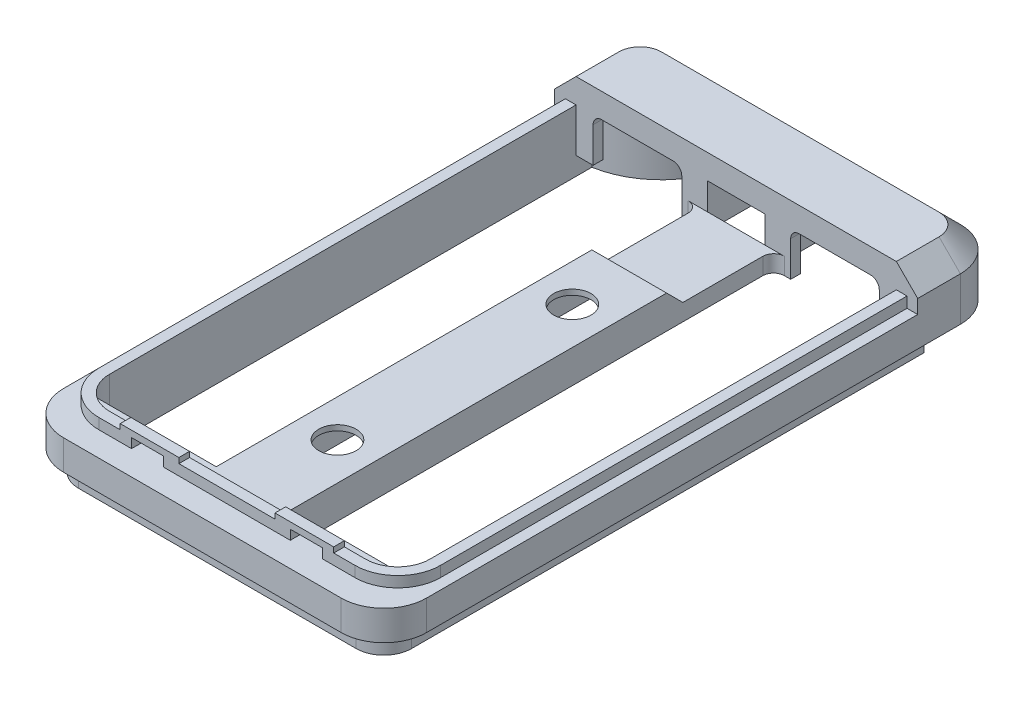
from build123d import *
from build123d.topology import SkipClean

# Parameters (mm, degrees)
BOSS_EXTRUDE2_DEPTH      = 5.8
BOSS_EXTRUDE5_DEPTH      = 17
BOSS_EXTRUDE5_DEPTH_BACK = 17
SKETCH20_W               = 8
SKETCH20_H               = 2.3
CUT_EXTRUDE3_DEPTH       = 35.112167917
BOSS_EXTRUDE6_DEPTH      = 5.8
CHAMFER1_SIZE            = 2
CUT_EXTRUDE4_START       = -1
CUT_EXTRUDE4_DEPTH       = 1
CUT_EXTRUDE5_DEPTH       = 35.112167917
BOSS_EXTRUDE8_DEPTH      = 5.8
SKETCH28_W               = 5.5
SKETCH28_H               = 1
BOSS_EXTRUDE9_DEPTH      = 0.5
CUT_EXTRUDE6_DEPTH       = 1
CUT_EXTRUDE7_DEPTH       = 2
CUT_EXTRUDE14_START      = -1.9
SKETCH45_W               = 3
SKETCH45_H               = 0.9
CUT_EXTRUDE14_DEPTH      = 1.9
CUT_EXTRUDE11_DEPTH      = 0.9
SKETCH40_W               = 30
SKETCH40_H               = 0.9
BOSS_EXTRUDE11_DEPTH     = 4.1
CUT_EXTRUDE12_REACH      = 55.429
CUT_EXTRUDE13_REACH      = 55.429
SKETCH47_W               = 0.6
SKETCH47_H               = 5
BOSS_EXTRUDE13_DEPTH     = 5.1
BOSS_EXTRUDE14_DEPTH     = 5.8
CUT_EXTRUDE23_DEPTH      = 6.7
BOSS_EXTRUDE15_DEPTH     = 1
SKETCH43_W               = 5.4
SKETCH43_H               = 0.5
SKETCH43_W_2             = 0.8
SKETCH43_H_2             = 1.075370029
BOSS_EXTRUDE17_DEPTH     = 45.2
SKETCH53_W               = 7
SKETCH53_H               = 36.7
BOSS_EXTRUDE18_DEPTH     = 1.52463
CHAMFER3_SIZE            = 1.52
CUT_EXTRUDE24_START      = -2.02463
SKETCH56_R               = 1.75
CUT_EXTRUDE24_DEPTH      = 2.02463
FILLET1_R                = 1
SKETCH57_W               = 5.4
SKETCH57_H               = 35.18
CUT_EXTRUDE25_DEPTH      = 1.52
CHAMFER4_SIZE            = 1.52
SKETCH59_W               = 0.8
SKETCH59_H               = 2.1
BOSS_EXTRUDE21_DEPTH     = 1.5
SKETCH61_W               = 4.290499921
SKETCH61_H               = 0.6
BOSS_EXTRUDE23_DEPTH     = 3.8
SKETCH64_W               = 4.8
SKETCH64_H               = 0.6
CUT_EXTRUDE26_DEPTH      = 1.7
CUT_EXTRUDE27_START      = -4.295370029
CUT_EXTRUDE27_DEPTH      = 4.295370029


with BuildPart() as part:
    # Sketch1 → Boss-Extrude2 (new body)
    with BuildSketch(Plane(origin=(0, 0, 0), x_dir=(1, 0, 0), z_dir=(0, 1, 0))):
        with BuildLine():
            Line((-13, 29), (13, 29))
            ThreePointArc((13, 29), (15.828427125, 27.828427125), (17, 25))
            Line((17, 25), (17, -25))
            ThreePointArc((17, -25), (15.828427125, -27.828427125), (13, -29))
            Line((13, -29), (-13, -29))
            ThreePointArc((-13, -29), (-15.828427125, -27.828427125), (-17, -25))
            Line((-17, -25), (-17, 25))
            ThreePointArc((-17, 25), (-15.828427125, 27.828427125), (-13, 29))
        make_face()
        with BuildLine():
            Line((-11, 27), (11, 27))
            ThreePointArc((11, 27), (13.828427125, 25.828427125), (15, 23))
            Line((15, 23), (15, -23))
            ThreePointArc((15, -23), (13.828427125, -25.828427125), (11, -27))
            Line((11, -27), (-11, -27))
            ThreePointArc((-11, -27), (-13.828427125, -25.828427125), (-15, -23))
            Line((-15, -23), (-15, 23))
            ThreePointArc((-15, 23), (-13.828427125, 25.828427125), (-11, 27))
        make_face(mode=Mode.SUBTRACT)
    extrude(amount=BOSS_EXTRUDE2_DEPTH)

    # Sketch20 → Boss-Extrude5 (add, two sides: drawn at the far end of the back side and taken through both)
    with BuildSketch(Plane(origin=(0, 0, 0), x_dir=(0, 0, -1), z_dir=(1, 0, 0)).offset(-BOSS_EXTRUDE5_DEPTH_BACK)):
        with Locations((25, 6.95)):
            Rectangle(SKETCH20_W, SKETCH20_H)
    extrude(amount=BOSS_EXTRUDE5_DEPTH + BOSS_EXTRUDE5_DEPTH_BACK)

    # Sketch22 → Cut-Extrude3 (cut, through all)
    with BuildSketch(Plane.XZ.offset(-5.8)):
        with BuildLine():
            Line((-17, -25), (-17, -29))
            Line((-17, -29), (-13, -29))
            ThreePointArc((-13, -29), (-15.828427125, -27.828427125), (-17, -25))
        make_face()
        with BuildLine():
            Line((13, -29), (17, -29))
            Line((17, -29), (17, -25))
            ThreePointArc((17, -25), (15.828427125, -27.828427125), (13, -29))
        make_face()
    extrude(amount=-CUT_EXTRUDE3_DEPTH, mode=Mode.SUBTRACT)

    # Sketch23 → Boss-Extrude6 (add, through all)
    with BuildSketch(Plane(origin=(0, 5.8, 0), x_dir=(1, 0, 0), z_dir=(0, 1, 0))):
        with BuildLine():
            Line((-17, -24.2), (17, -24.2))
            Line((17, -24.2), (17, -25))
            ThreePointArc((17, -25), (15.828427125, -27.828427125), (13, -29))
            Line((13, -29), (-13, -29))
            ThreePointArc((-13, -29), (-15.828427125, -27.828427125), (-17, -25))
            Line((-17, -25), (-17, -24.2))
        make_face()
    extrude(amount=-BOSS_EXTRUDE6_DEPTH)

    # Chamfer1
    chamfer1_edges = [part.edges().sort_by_distance(p)[0] for p in [
        (0, 8.1, -29),
        (-17, 8.1, -23),
        (17, 8.1, -23),
        (-15.828427125, 8.1, -27.828427125),
        (15.828427125, 8.1, -27.828427125),
    ]]
    chamfer(chamfer1_edges, length=CHAMFER1_SIZE)

    # Sketch26 → Cut-Extrude4 (cut)
    with BuildSketch(Plane(origin=(0, 5.8, 0), x_dir=(1, 0, 0), z_dir=(0, 1, 0)).offset(CUT_EXTRUDE4_START)):
        with BuildLine():
            Line((-16, 21), (-17, 21))
            Line((-17, 21), (-17, -25))
            ThreePointArc((-17, -25), (-15.828427125, -27.828427125), (-13, -29))
            Line((-13, -29), (13, -29))
            ThreePointArc((13, -29), (15.828427125, -27.828427125), (17, -25))
            Line((17, -25), (17, 21))
            Line((17, 21), (16, 21))
            Line((16, 21), (16, -22.7))
            ThreePointArc((16, -22.7), (14.828427125, -25.528427125), (12, -26.7))
            Line((12, -26.7), (-12, -26.7))
            ThreePointArc((-12, -26.7), (-14.828427125, -25.528427125), (-16, -22.7))
            Line((-16, -22.7), (-16, 21))
        make_face()
    extrude(amount=CUT_EXTRUDE4_DEPTH, mode=Mode.SUBTRACT)

    # Sketch27 → Cut-Extrude5 (cut, through all)
    with BuildSketch(Plane(origin=(0, 5.8, 0), x_dir=(1, 0, 0), z_dir=(0, 1, 0))):
        with BuildLine():
            Line((-15, -22.7), (15, -22.7))
            ThreePointArc((15, -22.7), (14.121320344, -24.821320344), (12, -25.7))
            Line((12, -25.7), (-12, -25.7))
            ThreePointArc((-12, -25.7), (-14.121320344, -24.821320344), (-15, -22.7))
        make_face()
    extrude(amount=-CUT_EXTRUDE5_DEPTH, mode=Mode.SUBTRACT)

    # Sketch25 → Boss-Extrude8 (add, through all)
    with BuildSketch(Plane(origin=(0, 5.8, 0), x_dir=(1, 0, 0), z_dir=(0, 1, 0))):
        with BuildLine():
            Line((15, 21), (15, -22.7))
            ThreePointArc((15, -22.7), (14.121320344, -24.821320344), (12, -25.7))
            Line((12, -25.7), (-12, -25.7))
            ThreePointArc((-12, -25.7), (-14.121320344, -24.821320344), (-15, -22.7))
            Line((-15, -22.7), (-15, 21))
            Line((-15, 21), (-16, 21))
            Line((-16, 21), (-16, -22.7))
            ThreePointArc((-16, -22.7), (-14.828427125, -25.528427125), (-12, -26.7))
            Line((-12, -26.7), (12, -26.7))
            ThreePointArc((12, -26.7), (14.828427125, -25.528427125), (16, -22.7))
            Line((16, -22.7), (16, 21))
            Line((16, 21), (15, 21))
        make_face()
    extrude(amount=-BOSS_EXTRUDE8_DEPTH)

    # Sketch28 → Boss-Extrude9 (add)
    with BuildSketch(Plane(origin=(0, 5.8, 0), x_dir=(1, 0, 0), z_dir=(0, 1, 0))):
        with Locations((-7.25, -26.2)):
            Rectangle(SKETCH28_W, SKETCH28_H)
        with Locations((7.25, -26.2)):
            Rectangle(SKETCH28_W, SKETCH28_H)
    extrude(amount=BOSS_EXTRUDE9_DEPTH)

    # Sketch29 → Cut-Extrude6 (cut)
    with BuildSketch(Plane.XY.offset(26.7)):
        Polygon((-7.434487223, 4.8), (-5.934487223, 4.8), (-5.934487223, 5.7), (-8.934487223, 5.7), (-8.934487223, 4.8), align=None)
        Polygon((8.934487223, 5.7), (5.934487223, 5.7), (5.934487223, 4.8), (7.434487223, 4.8), (8.934487223, 4.8), align=None)
    extrude(amount=-CUT_EXTRUDE6_DEPTH, mode=Mode.SUBTRACT)

    # Sketch33 → Cut-Extrude7 (cut)
    with BuildSketch(Plane.XZ):
        with BuildLine():
            Line((-13, -29), (13, -29))
            ThreePointArc((13, -29), (15.828427125, -27.828427125), (17, -25))
            Line((17, -25), (17, 25))
            ThreePointArc((17, 25), (15.828427125, 27.828427125), (13, 29))
            Line((13, 29), (-13, 29))
            ThreePointArc((-13, 29), (-15.828427125, 27.828427125), (-17, 25))
            Line((-17, 25), (-17, -25))
            ThreePointArc((-17, -25), (-15.828427125, -27.828427125), (-13, -29))
        make_face()
        with BuildLine():
            Line((-15.6, 25), (-15.6, -25))
            ThreePointArc((-15.6, -25), (-14.838477631, -26.838477631), (-13, -27.6))
            Line((-13, -27.6), (13, -27.6))
            ThreePointArc((13, -27.6), (14.838477631, -26.838477631), (15.6, -25))
            Line((15.6, -25), (15.6, 25))
            ThreePointArc((15.6, 25), (14.838477631, 26.838477631), (13, 27.6))
            Line((13, 27.6), (-13, 27.6))
            ThreePointArc((-13, 27.6), (-14.838477631, 26.838477631), (-15.6, 25))
        make_face(mode=Mode.SUBTRACT)
    extrude(amount=-CUT_EXTRUDE7_DEPTH, mode=Mode.SUBTRACT)

    # Sketch45 → Cut-Extrude14 (cut)
    with BuildSketch(Plane.XY.offset(27.6).offset(CUT_EXTRUDE14_START)):
        with Locations((7.434487223, 1.55)):
            Rectangle(SKETCH45_W, SKETCH45_H)
        with Locations((-7.434487223, 1.55)):
            Rectangle(SKETCH45_W, SKETCH45_H)
    extrude(amount=CUT_EXTRUDE14_DEPTH, mode=Mode.SUBTRACT)

    # Sketch39 → Cut-Extrude11 (cut)
    with BuildSketch(Plane.XZ.offset(-5.8)):
        with BuildLine():
            Line((15, -21.9), (-15, -21.9))
            Line((-15, -21.9), (-15, -23))
            ThreePointArc((-15, -23), (-13.828427125, -25.828427125), (-11, -27))
            Line((-11, -27), (11, -27))
            ThreePointArc((11, -27), (13.828427125, -25.828427125), (15, -23))
            Line((15, -23), (15, -21.9))
        make_face()
    extrude(amount=-CUT_EXTRUDE11_DEPTH, mode=Mode.SUBTRACT)

    # Sketch40 → Boss-Extrude11 (add)
    with BuildSketch(Plane.XZ.offset(-5.8)):
        with Locations((0, -21.45)):
            Rectangle(SKETCH40_W, SKETCH40_H)
    extrude(amount=BOSS_EXTRUDE11_DEPTH)

    # Sketch38 → Cut-Extrude12 (cut, up to next)
    with BuildSketch(Plane.XY.offset(-21), mode=Mode.PRIVATE) as cut_extrude12_sk1:
        Polygon((2.7, 5.8), (0, 5.8), (-2.7, 5.8), (-2.7, 1.285789379), (2.7, 1.285789379), align=None)
    cut_extrude12_tool1 = extrude(cut_extrude12_sk1.sketch, amount=-CUT_EXTRUDE12_REACH, mode=Mode.PRIVATE) & part.part
    add(cut_extrude12_tool1.solids().sort_by_distance((0, 3.542895, -21))[0], mode=Mode.SUBTRACT)

    # Sketch41 → Cut-Extrude13 (cut, up to next)
    with BuildSketch(Plane.XY.offset(-21), mode=Mode.PRIVATE) as cut_extrude13_sk1:
        with BuildLine():
            Line((5.9, 5.8), (12.6, 5.8))
            ThreePointArc((12.6, 5.8), (13.165685425, 5.565685425), (13.4, 5))
            Line((13.4, 5), (13.4, 1.7))
            Line((13.4, 1.7), (5.1, 1.7))
            Line((5.1, 1.7), (5.1, 5))
            ThreePointArc((5.1, 5), (5.334314575, 5.565685425), (5.9, 5.8))
        make_face()
    cut_extrude13_tool1 = extrude(cut_extrude13_sk1.sketch, amount=-CUT_EXTRUDE13_REACH, mode=Mode.PRIVATE) & part.part
    # Sketch41 → Cut-Extrude13 (cut, up to next)
    with BuildSketch(Plane.XY.offset(-21), mode=Mode.PRIVATE) as cut_extrude13_sk2:
        with BuildLine():
            Line((-5.1, 5), (-5.1, 1.7))
            Line((-5.1, 1.7), (-13.4, 1.7))
            Line((-13.4, 1.7), (-13.4, 5))
            ThreePointArc((-13.4, 5), (-13.165685425, 5.565685425), (-12.6, 5.8))
            Line((-12.6, 5.8), (-5.9, 5.8))
            ThreePointArc((-5.9, 5.8), (-5.334314575, 5.565685425), (-5.1, 5))
        make_face()
    cut_extrude13_tool2 = extrude(cut_extrude13_sk2.sketch, amount=-CUT_EXTRUDE13_REACH, mode=Mode.PRIVATE) & part.part
    add(cut_extrude13_tool1.solids().sort_by_distance((9.25, 3.734772, -21))[0], mode=Mode.SUBTRACT)
    add(cut_extrude13_tool2.solids().sort_by_distance((-9.25, 3.734772, -21))[0], mode=Mode.SUBTRACT)

    # Sketch47 → Boss-Extrude13 (add)
    with BuildSketch(Plane(origin=(0, 0, -21.9), x_dir=(-1, 0, 0), z_dir=(0, 0, -1))):
        with Locations((3, 4.2)):
            Rectangle(SKETCH47_W, SKETCH47_H)
        with Locations((-3, 4.2)):
            Rectangle(SKETCH47_W, SKETCH47_H)
    extrude(amount=BOSS_EXTRUDE13_DEPTH)

    # Sketch50 → Boss-Extrude14 (add)
    with BuildSketch(Plane.XZ):
        with BuildLine():
            ThreePointArc((15.6, -22.4), (11.498859301, -24.0321841), (8.9, -27.6))
            Line((8.9, -27.6), (9.5, -27.6))
            ThreePointArc((9.5, -27.6), (11.887551109, -24.421535167), (15.6, -23))
            Line((15.6, -23), (15.6, -22.4))
        make_face()
        with BuildLine():
            Line((-15.6, -22.4), (-15.6, -23))
            ThreePointArc((-15.6, -23), (-11.887551109, -24.421535167), (-9.5, -27.6))
            Line((-9.5, -27.6), (-8.9, -27.6))
            ThreePointArc((-8.9, -27.6), (-11.498859301, -24.0321841), (-15.6, -22.4))
        make_face()
    extrude(amount=-BOSS_EXTRUDE14_DEPTH)

    # Sketch50<6> → Cut-Extrude23 (cut)
    with SkipClean():  # the faces are left unmerged after this step: merging them gives an invalid solid
        with BuildSketch(Plane.XZ):
            with BuildLine():
                ThreePointArc((-14.999259325, -23.076973055), (-15.298817872, -23.032150864), (-15.6, -23))
                Line((-15.6, -23), (-15.6, -25))
                ThreePointArc((-15.6, -25), (-14.838477631, -26.838477631), (-13, -27.6))
                Line((-13, -27.6), (-9.5, -27.6))
                ThreePointArc((-9.5, -27.6), (-9.623329595, -27.297034905), (-9.760327053, -27))
                Line((-9.760327053, -27), (-11, -27))
                ThreePointArc((-11, -27), (-13.801080843, -25.855511532), (-14.999259325, -23.076973055))
            make_face()
            with BuildLine():
                Line((9.5, -27.6), (13, -27.6))
                ThreePointArc((13, -27.6), (14.838477631, -26.838477631), (15.6, -25))
                Line((15.6, -25), (15.6, -23))
                ThreePointArc((15.6, -23), (15.298817872, -23.032150864), (14.999259325, -23.076973055))
                ThreePointArc((14.999259325, -23.076973055), (13.801080843, -25.855511532), (11, -27))
                Line((11, -27), (9.760327053, -27))
                ThreePointArc((9.760327053, -27), (9.623329595, -27.297034905), (9.5, -27.6))
            make_face()
        extrude(amount=-CUT_EXTRUDE23_DEPTH, mode=Mode.SUBTRACT)

    # Sketch51 → Boss-Extrude15 (add)
    with SkipClean():  # the faces are left unmerged after this step: merging them gives an invalid solid
        with BuildSketch(Plane(origin=(0, 4.8, 0), x_dir=(1, 0, 0), z_dir=(0, 1, 0))):
            with BuildLine():
                Line((0, -24.2), (-14.598076211, -24.2))
                ThreePointArc((-14.598076211, -24.2), (-13.5, -25.298076211), (-12, -25.7))
                Line((-12, -25.7), (-10, -25.7))
                Line((-10, -25.7), (-4.5, -25.7))
                Line((-4.5, -25.7), (4.5, -25.7))
                Line((4.5, -25.7), (10, -25.7))
                Line((10, -25.7), (12, -25.7))
                ThreePointArc((12, -25.7), (13.5, -25.298076211), (14.598076211, -24.2))
                Line((14.598076211, -24.2), (0, -24.2))
            make_face()
        extrude(amount=-BOSS_EXTRUDE15_DEPTH)

    # Sketch43 → Boss-Extrude17 (add)
    with SkipClean():  # the faces are left unmerged after this step: merging them gives an invalid solid
        with BuildSketch(Plane.XY.offset(-21)):
            with Locations((0, 3.025370029)):
                Rectangle(SKETCH43_W, SKETCH43_H)
            with Locations((-3.1, 3.025370029)):
                Rectangle(SKETCH43_W_2, SKETCH43_H)
            with Locations((-3.1, 2.237685015)):
                Rectangle(SKETCH43_W_2, SKETCH43_H_2)
            with Locations((3.1, 2.237685015)):
                Rectangle(SKETCH43_W_2, SKETCH43_H_2)
            with Locations((3.1, 3.025370029)):
                Rectangle(SKETCH43_W_2, SKETCH43_H)
        extrude(amount=BOSS_EXTRUDE17_DEPTH)

    # Sketch53 → Boss-Extrude18 (add)
    with SkipClean():  # the faces are left unmerged after this step: merging them gives an invalid solid
        with BuildSketch(Plane(origin=(0, 3.275370029, 0), x_dir=(1, 0, 0), z_dir=(0, 1, 0))):
            with Locations((0, -5.85)):
                Rectangle(SKETCH53_W, SKETCH53_H)
        extrude(amount=BOSS_EXTRUDE18_DEPTH)

    # Chamfer3
    chamfer3_edges = [part.edges().sort_by_distance(p)[0] for p in [
        (0, 4.800000029, -12.5),
    ]]
    chamfer(chamfer3_edges, length=CHAMFER3_SIZE)

    # Sketch56 → Cut-Extrude24 (cut)
    with SkipClean():  # the faces are left unmerged after this step: merging them gives an invalid solid
        with BuildSketch(Plane(origin=(0, 4.8, 0), x_dir=(1, 0, 0), z_dir=(0, 1, 0)).offset(CUT_EXTRUDE24_START)):
            with Locations(Location((0, -16.35, 0), (0, 0, 270))):
                Circle(SKETCH56_R)
            with Locations(Location((0, 5.65, 0), (0, 0, 270))):
                Circle(SKETCH56_R)
        extrude(amount=CUT_EXTRUDE24_DEPTH, mode=Mode.SUBTRACT)

    # Fillet1
    fillet1_edges = [part.edges().sort_by_distance(p)[0] for p in [
        (-3.5, 2.487685015, -21),
        (3.5, 2.487685015, -21),
    ]]
    fillet(fillet1_edges, radius=FILLET1_R)

    # Sketch57 → Cut-Extrude25 (cut)
    with SkipClean():  # the faces are left unmerged after this step: merging them gives an invalid solid
        with BuildSketch(Plane.XZ.offset(-2.775370029)):
            with Locations((0, 6.61)):
                Rectangle(SKETCH57_W, SKETCH57_H)
        extrude(amount=-CUT_EXTRUDE25_DEPTH, mode=Mode.SUBTRACT)

    # Chamfer4
    chamfer4_edges = [part.edges().sort_by_distance(p)[0] for p in [
        (0, 4.295370029, -10.98),
    ]]
    chamfer(chamfer4_edges, length=CHAMFER4_SIZE - 0.0001)  # a hair under: the kernel refuses the full size

    # Sketch59 → Boss-Extrude21 (add)
    with BuildSketch(Plane.XY.offset(24.2)):
        with Locations((3.1, 2.75)):
            Rectangle(SKETCH59_W, SKETCH59_H)
        with Locations((-3.1, 2.75)):
            Rectangle(SKETCH59_W, SKETCH59_H)
    extrude(amount=BOSS_EXTRUDE21_DEPTH)

    # Sketch61 → Boss-Extrude23 (add)
    with BuildSketch(Plane.XZ.offset(-3.8)):
        with BuildLine():
            Line((-7.790499921, 24.2), (-7.790499921, 24.8))
            Line((-7.790499921, 24.8), (-14.11637904, 24.8))
            Line((-14.11637904, 24.8), (-14.142428529, 24.8))
            ThreePointArc((-14.142428529, 24.8), (-14.389162258, 24.514360411), (-14.598076211, 24.2))
            Line((-14.598076211, 24.2), (-7.790499921, 24.2))
        make_face()
        with Locations((-5.645249961, 24.5)):
            Rectangle(SKETCH61_W, SKETCH61_H)
        Polygon((14.115997682, 24.8), (-3.5, 24.8), (-3.5, 24.2), (15.044287411, 24.2), (15.044287411, 24.8), align=None)
    extrude(amount=BOSS_EXTRUDE23_DEPTH)

    # Sketch64 → Cut-Extrude26 (cut)
    with BuildSketch(Plane.XZ):
        with Locations((-2.4, 24.5)):
            Rectangle(SKETCH64_W, SKETCH64_H)
        with Locations((2.4, 24.5)):
            Rectangle(SKETCH64_W, SKETCH64_H)
    extrude(amount=-CUT_EXTRUDE26_DEPTH, mode=Mode.SUBTRACT)

    # Sketch65 → Cut-Extrude27 (cut)
    with BuildSketch(Plane.XZ.offset(CUT_EXTRUDE27_START)):
        with BuildLine():
            Line((11.133212655, 26.5), (0, 26.5))
            Line((0, 26.5), (-12, 26.5))
            ThreePointArc((-12, 26.5), (-12.00193035, 26.499999379), (-12.0038607, 26.499997516))
            ThreePointArc((-12.0038607, 26.499997516), (-13.598505772, 26.038656987), (-14.703701167, 24.8))
            Line((-14.703701167, 24.8), (-14.142428529, 24.8))
            ThreePointArc((-14.142428529, 24.8), (-13.161895004, 25.465863337), (-12, 25.7))
            Line((-12, 25.7), (12, 25.7))
            ThreePointArc((12, 25.7), (13.161895004, 25.465863337), (14.142428529, 24.8))
            Line((14.142428529, 24.8), (14.703701167, 24.8))
            ThreePointArc((14.703701167, 24.8), (13.596871942, 26.03968502), (12, 26.5))
            Line((12, 26.5), (11.133212655, 26.5))
        make_face()
        with BuildLine():
            ThreePointArc((-12, 25.7), (-13.161895004, 25.465863337), (-14.142428529, 24.8))
            Line((-14.142428529, 24.8), (-4.8, 24.8))
            Line((-4.8, 24.8), (4.8, 24.8))
            Line((4.8, 24.8), (14.142428529, 24.8))
            ThreePointArc((14.142428529, 24.8), (13.161895004, 25.465863337), (12, 25.7))
            Line((12, 25.7), (-12, 25.7))
        make_face()
    extrude(amount=CUT_EXTRUDE27_DEPTH, mode=Mode.SUBTRACT)


solid = part.part
